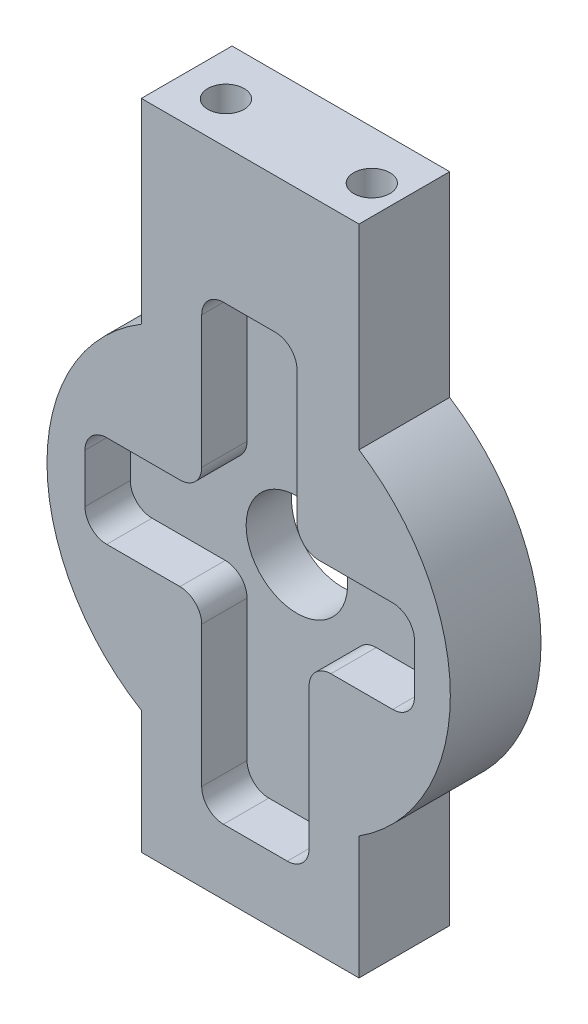
from build123d import *

# Parameters (mm, degrees)
SKETCH1_R           = 2.8
BOSS_EXTRUDE1_DEPTH = 5
CUT_EXTRUDE1_DEPTH  = 2.5
FILLET1_R           = 1.2
SKETCH3_R           = 1
CUT_EXTRUDE2_DEPTH  = 8
SKETCH4_R           = 1
CUT_EXTRUDE3_DEPTH  = 8


with BuildPart() as part:
    # Sketch1 → Boss-Extrude1 (new body)
    with BuildSketch(Plane.XY.offset(10)):
        with BuildLine():
            Line((-253, 244), (-241, 244))
            Line((-241, 244), (-241, 233.219543457))
            ThreePointArc((-241, 233.219543457), (-235.964643127, 224), (-241, 214.780456543))
            Line((-241, 214.780456543), (-241, 208))
            Line((-241, 208), (-253, 208))
            Line((-253, 208), (-253, 214.780456543))
            ThreePointArc((-253, 214.780456543), (-258.20228405, 224), (-253, 233.219543457))
            Line((-253, 233.219543457), (-253, 244))
        make_face()
        with Locations((-246.922635101, 224)):
            Circle(SKETCH1_R, mode=Mode.SUBTRACT)
    extrude(amount=BOSS_EXTRUDE1_DEPTH)

    # Sketch2 → Cut-Extrude1 (cut)
    with BuildSketch(Plane.XY.offset(15)):
        Polygon((-249.671711, 236.526764937), (-244.414971283, 236.526764937), (-244.414971283, 226.843297037), (-237.940881316, 226.843297037), (-237.940881316, 221.752559627), (-243.750962055, 221.752559627), (-243.750962055, 211.604094919), (-249.671711, 211.604094919), (-249.671711, 221.752559627), (-256.108895334, 221.752559627), (-256.108895334, 226.843297037), (-249.671711, 226.843297037), align=None)
    extrude(amount=-CUT_EXTRUDE1_DEPTH, mode=Mode.SUBTRACT)

    # Fillet1
    fillet1_edges = [part.edges().sort_by_distance(p)[0] for p in [
        (-256.108895334, 226.843297037, 13.75),
        (-256.108895334, 221.752559627, 13.75),
        (-249.671711, 221.752559627, 13.75),
        (-249.671711, 211.604094919, 13.75),
        (-243.750962055, 211.604094919, 13.75),
        (-243.750962055, 221.752559627, 13.75),
        (-237.940881316, 221.752559627, 13.75),
        (-237.940881316, 226.843297037, 13.75),
        (-244.414971283, 226.843297037, 13.75),
        (-249.671711, 226.843297037, 13.75),
        (-249.671711, 236.526764937, 13.75),
        (-244.414971283, 236.526764937, 13.75),
    ]]
    fillet(fillet1_edges, radius=FILLET1_R)

    # Sketch3 → Cut-Extrude2 (cut)
    with BuildSketch(Plane(origin=(0, 208, 0), x_dir=(-1, 0, 0), z_dir=(0, -1, 0))):
        with Locations((250.9, -12.2)):
            Circle(SKETCH3_R)
        with Locations((242.9, -12.2)):
            Circle(SKETCH3_R)
    extrude(amount=-CUT_EXTRUDE2_DEPTH, mode=Mode.SUBTRACT)

    # Sketch4 → Cut-Extrude3 (cut)
    with BuildSketch(Plane(origin=(0, 244, 0), x_dir=(1, 0, 0), z_dir=(0, 1, 0))):
        with Locations((-242.598801613, -12.694978247)):
            Circle(SKETCH4_R)
        with Locations((-250.64051394, -12.694978247)):
            Circle(SKETCH4_R)
    extrude(amount=-CUT_EXTRUDE3_DEPTH, mode=Mode.SUBTRACT)


solid = part.part
